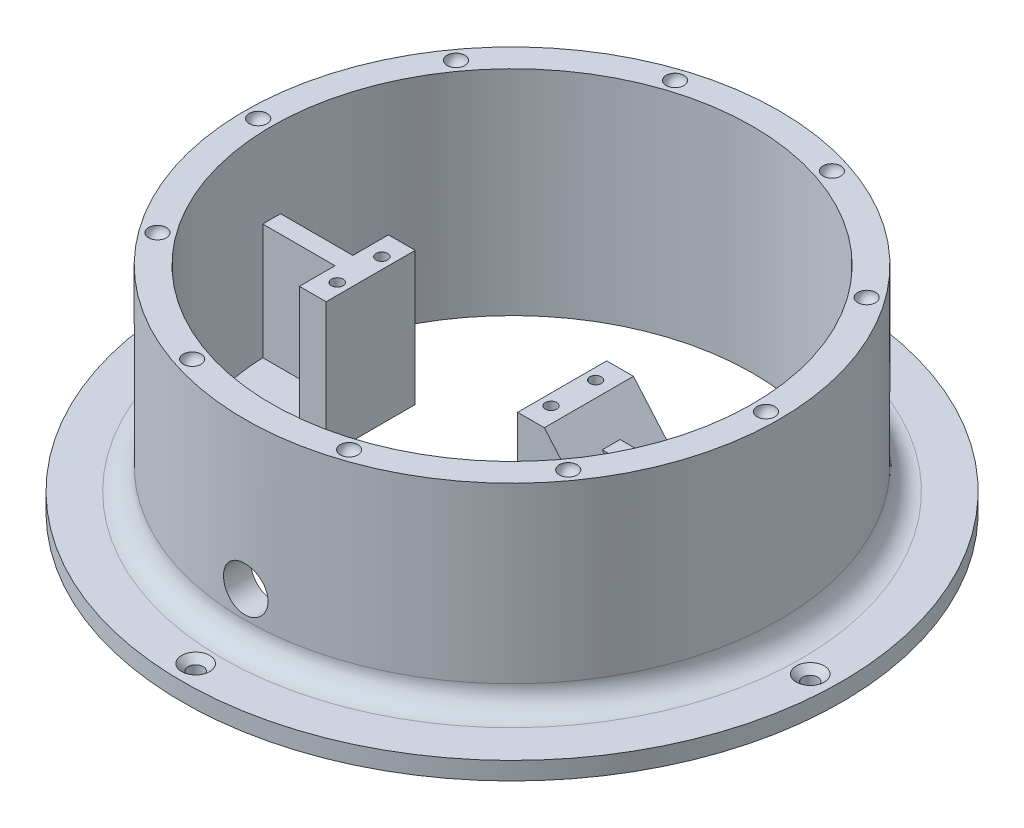
from build123d import *

# Parameters (mm, degrees)
FILLET1_R                                            = 5
CSK_FOR_M3_COUNTERSUNK_RAISED_HEAD_SCREW_D           = 3.4
CSK_FOR_M3_COUNTERSUNK_RAISED_HEAD_SCREW_CSINK_D     = 6.3
CSK_FOR_M3_COUNTERSUNK_RAISED_HEAD_SCREW_CSINK_ANGLE = 90
CIRPATTERN2_COUNT                                    = 4
CIRPATTERN3_COUNT                                    = 10
BOSS_EXTRUDE1_DEPTH                                  = 10
SKETCH14_R                                           = 1.3
CUT_EXTRUDE1_DEPTH                                   = 8
RIB1_REACH                                           = 117.135
SKETCH15_WALL_W                                      = 251.269407434
SKETCH15_WALL_H                                      = 4
RIB2_REACH                                           = 117.135
SKETCH16_WALL_W                                      = 266.269407434
SKETCH16_WALL_H                                      = 4
CUT_EXTRUDE3_REACH                                   = 117.135
SKETCH17_R                                           = 5


with BuildPart() as part:
    # Sketch1 → Revolve2 (revolve)
    with BuildSketch(Plane.XY):
        Polygon((54, 0), (54, 48), (60, 48), (60, 4), (74, 4), (74, 0), align=None)
    revolve(axis=Axis((0, 0, 0), (0, 1, 0)))

    # Fillet1
    fillet1_edges = [part.edges().sort_by_distance(p)[0] for p in [
        (-60, 4, 0),
    ]]
    fillet(fillet1_edges, radius=FILLET1_R)

    # CSK for M3 Countersunk Raised Head Screw1 (through all)
    with Locations(Plane(origin=(0, 4, 0), x_dir=(1, 0, 0), z_dir=(0, 1, 0))):
        with Locations((2.044890775, 69)):
            csk_for_m3_countersunk_raised_head_screw = CounterSinkHole(CSK_FOR_M3_COUNTERSUNK_RAISED_HEAD_SCREW_D / 2, CSK_FOR_M3_COUNTERSUNK_RAISED_HEAD_SCREW_CSINK_D / 2, counter_sink_angle=CSK_FOR_M3_COUNTERSUNK_RAISED_HEAD_SCREW_CSINK_ANGLE)

    # CirPattern2: CSK for M3 Countersunk Raised Head Screw1 ×4 about axis
    cirpattern2_axis = Axis((0, 4, 0), (0, -1, 0))
    for i in range(1, CIRPATTERN2_COUNT):
        add(csk_for_m3_countersunk_raised_head_screw.rotate(cirpattern2_axis, i * 360 / CIRPATTERN2_COUNT), mode=Mode.SUBTRACT)

    # Sketch10 → Cut-Revolve3 (revolve, cut)
    with BuildSketch(Plane.XY):
        with BuildLine():
            Line((57, 46), (57, 50))
            ThreePointArc((57, 50), (59, 48), (57, 46))
        make_face()
    cut_revolve3 = revolve(axis=Axis((57, 46, 0), (0, 1, 0)), mode=Mode.SUBTRACT)

    # CirPattern3: Cut-Revolve3 ×10 about axis
    cirpattern3_axis = Axis((0, 0, 0), (0, -1, 0))
    for i in range(1, CIRPATTERN3_COUNT):
        add(cut_revolve3.rotate(cirpattern3_axis, i * 360 / CIRPATTERN3_COUNT), mode=Mode.SUBTRACT)

    # Sketch11 → Boss-Extrude1 (add, symmetric)
    with BuildSketch(Plane.XY):
        Polygon((22.25, 0), (56.25, 0), (56.25, 4), (30.25, 4), (30.25, 14.938933676), (17.25, 30), (11.25, 30), (11.25, 20), (22.25, 6.890710481), align=None)
        Polygon((-37.75, 30), (-37.75, 4), (-56.75, 4), (-56.75, 0), (-31.75, 0), (-31.75, 30), align=None)
    extrude(amount=BOSS_EXTRUDE1_DEPTH, both=True)

    # Sketch14 → Cut-Extrude1 (cut)
    with BuildSketch(Plane(origin=(0, 30, 0), x_dir=(1, 0, 0), z_dir=(0, 1, 0))):
        with Locations((-34.25, 5)):
            Circle(SKETCH14_R)
        with Locations((-34.25, -5)):
            Circle(SKETCH14_R)
        with Locations((13.75, 5)):
            Circle(SKETCH14_R)
        with Locations((13.75, -5)):
            Circle(SKETCH14_R)
    extrude(amount=-CUT_EXTRUDE1_DEPTH, mode=Mode.SUBTRACT)

    # Sketch15 wall → Rib1 (add, up to next)
    with BuildSketch(Plane(origin=(-47.25, 30, 0), x_dir=(-1, 0, 0), z_dir=(0, -1, 0)), mode=Mode.PRIVATE) as rib1_sk1:
        Rectangle(SKETCH15_WALL_W, SKETCH15_WALL_H)
    rib1_tool1 = extrude(rib1_sk1.sketch, amount=RIB1_REACH, mode=Mode.PRIVATE) - part.part
    add(rib1_tool1.solids().sort_by_distance((-47.25, 30, 0))[0])

    # Sketch16 wall → Rib2 (add, up to next)
    with BuildSketch(Plane(origin=(39.25, 24.207282183, 0), x_dir=(1, 0, 0), z_dir=(0, 1, 0)), mode=Mode.PRIVATE) as rib2_sk1:
        Rectangle(SKETCH16_WALL_W, SKETCH16_WALL_H)
    rib2_tool1 = extrude(rib2_sk1.sketch, amount=-RIB2_REACH, mode=Mode.PRIVATE) - part.part
    add(rib2_tool1.solids().sort_by_distance((39.25, 24.207282183, 0))[0])

    # Sketch17 → Cut-Extrude3 (cut, up to next)
    with BuildSketch(Plane.XY, mode=Mode.PRIVATE) as cut_extrude3_sk1:
        with Locations((0, 15)):
            Circle(SKETCH17_R)
    cut_extrude3_tool1 = extrude(cut_extrude3_sk1.sketch, amount=CUT_EXTRUDE3_REACH, mode=Mode.PRIVATE) & part.part
    add(cut_extrude3_tool1.solids().sort_by_distance((0, 15, 0))[0], mode=Mode.SUBTRACT)


solid = part.part
